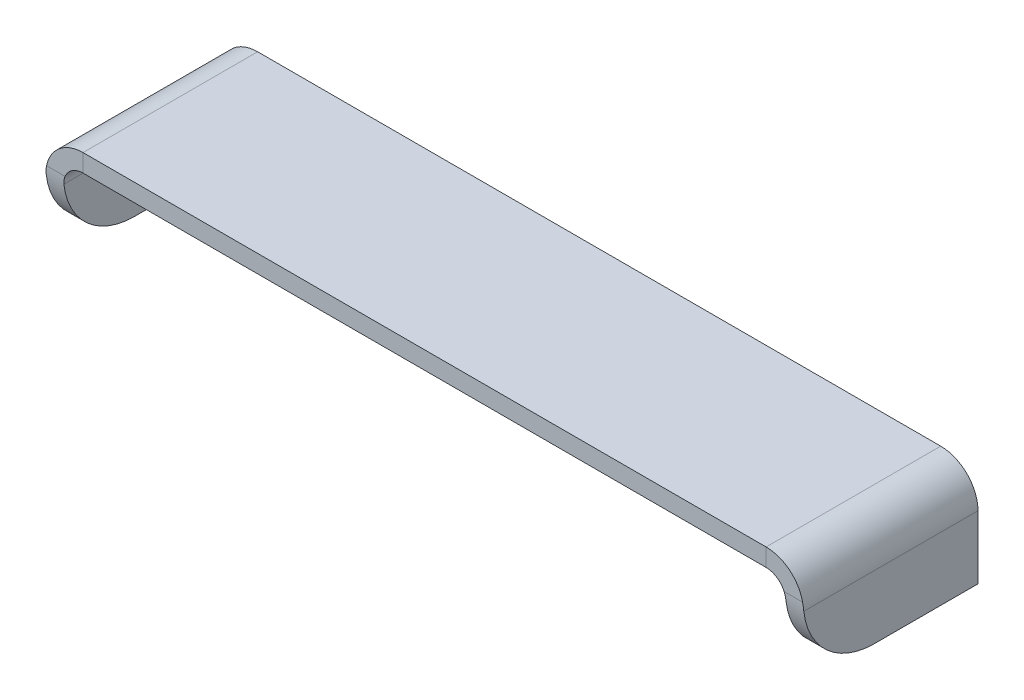
from build123d import *

# Parameters (mm, degrees)
SKETCH1_W                      = 64
SKETCH1_H                      = 14.75
BASE_FLANGE1_DEPTH             = 1.5
EDGE_FLANGE1_STRIP_W           = 9.3
EDGE_FLANGE1_STRIP_H           = 1.5
EDGE_FLANGE1_STRIP_CUT_DEPTH   = 14.75
EDGE_FLANGE1_STRIP_2_W         = 9.3
EDGE_FLANGE1_STRIP_2_H         = 1.5
EDGE_FLANGE1_STRIP_CUT_2_DEPTH = 14.75
EDGE_FLANGE1_DEPTH             = 14.75
EDGE_FLANGE1_BEND_DEPTH        = 14.75
FILLET1_R                      = 6


# Sheet-metal steps are written as plain solids
with BuildPart() as part:
    # Sketch1 → Base-Flange1 (new body)
    with BuildSketch(Plane(origin=(0, 0, 0), x_dir=(1, 0, 0), z_dir=(0, 1, 0))):
        with Locations((32, 7.375)):
            Rectangle(SKETCH1_W, SKETCH1_H)
    extrude(amount=-BASE_FLANGE1_DEPTH)

    # Edge-Flange1 strip (across the edge) → Edge-Flange1 strip cut (cut)
    with BuildSketch(Plane(origin=(0, -1.5, 0), x_dir=(1, 0, 0), z_dir=(0, 0, -1))):
        with Locations((-1.5, -0.75)):
            Rectangle(EDGE_FLANGE1_STRIP_W, EDGE_FLANGE1_STRIP_H)
    extrude(amount=EDGE_FLANGE1_STRIP_CUT_DEPTH, mode=Mode.SUBTRACT)

    # Edge-Flange1 strip 2 (across the edge) → Edge-Flange1 strip cut 2 (cut)
    with BuildSketch(Plane(origin=(64, -1.5, -14.75), x_dir=(-1, 0, 0), z_dir=(0, 0, 1))):
        with Locations((-1.5, -0.75)):
            Rectangle(EDGE_FLANGE1_STRIP_2_W, EDGE_FLANGE1_STRIP_2_H)
    extrude(amount=EDGE_FLANGE1_STRIP_CUT_2_DEPTH, mode=Mode.SUBTRACT)

    # Edge-Flange1 section (across the edge) → Edge-Flange1 (add)
    with BuildSketch(Plane(origin=(0, -1.5, 0), x_dir=(1, 0, 0), z_dir=(0, 0, -1))):
        with BuildLine():
            Line((0, 1.65), (0, 7))
            Line((0, 7), (1.5, 7))
            Line((1.5, 7), (1.5, 1.65))
            ThreePointArc((1.5, 1.65), (1.983273811, 0.483273811), (3.15, 0))
            Line((3.15, 0), (3.15, -1.5))
            ThreePointArc((3.15, -1.5), (0.922613639, -0.577386361), (0, 1.65))
        make_face()
    extrude(amount=EDGE_FLANGE1_DEPTH)

    # Edge-Flange1 section 2 (across the edge) → Edge-Flange1 bend (add)
    with BuildSketch(Plane(origin=(64, -1.5, -14.75), x_dir=(-1, 0, 0), z_dir=(0, 0, 1))):
        with BuildLine():
            Line((0, 1.65), (0, 7))
            Line((0, 7), (1.5, 7))
            Line((1.5, 7), (1.5, 1.65))
            ThreePointArc((1.5, 1.65), (1.983273811, 0.483273811), (3.15, 0))
            Line((3.15, 0), (3.15, -1.5))
            ThreePointArc((3.15, -1.5), (0.922613639, -0.577386361), (0, 1.65))
        make_face()
    extrude(amount=EDGE_FLANGE1_BEND_DEPTH)

    # Fillet1
    fillet1_edges = [part.edges().sort_by_distance(p)[0] for p in [
        (0.75, -8.5, 0),
        (63.25, -8.5, 0),
    ]]
    fillet(fillet1_edges, radius=FILLET1_R)


solid = part.part
